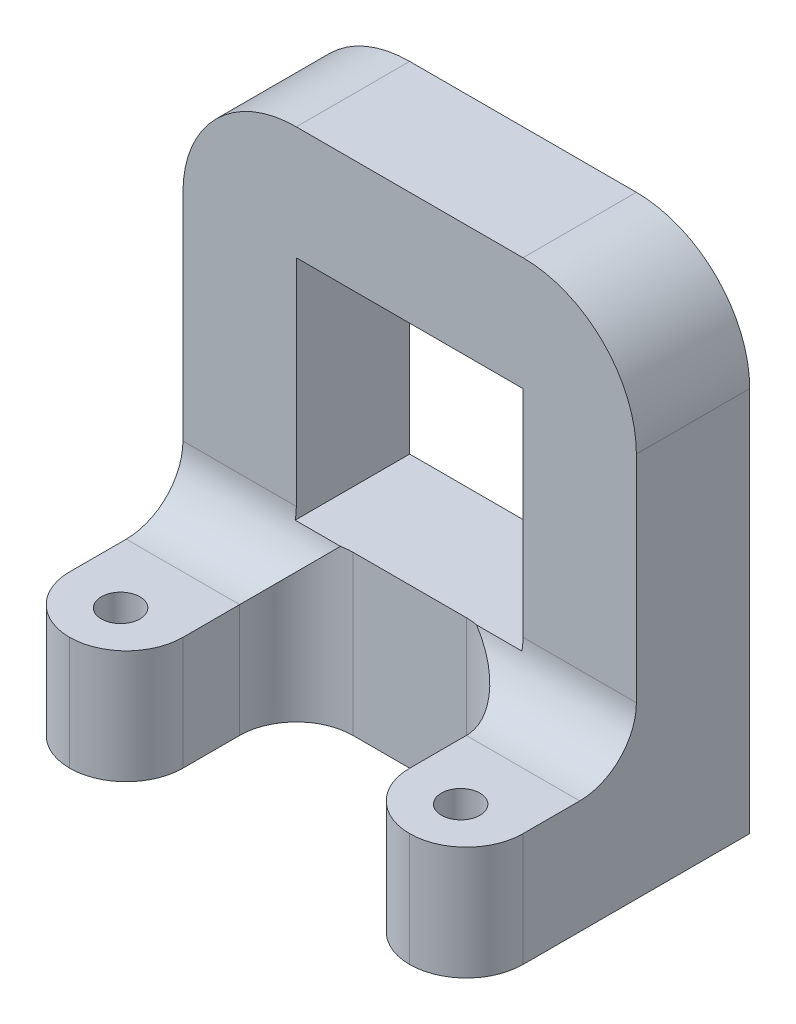
from build123d import *

# Parameters (mm, degrees)
ESQUISSE1_W        = 40
ESQUISSE1_H        = 44
ESQUISSE1_W_2      = 20
ESQUISSE1_H_2      = 20
BOSS_EXTRU_1_DEPTH = 10
ESQUISSE3_W        = 10
ESQUISSE3_H        = 10
BOSS_EXTRU_2_DEPTH = 15
D_GAGEMENT_M31_D   = 3.4
CONG_2_R           = 10
CONG_3_R           = 5


with BuildPart() as part:
    # Esquisse1 → Boss.-Extru.1 (new body)
    with BuildSketch(Plane.XY):
        with Locations((20, 22)):
            Rectangle(ESQUISSE1_W, ESQUISSE1_H)
        with Locations((20, 24)):
            Rectangle(ESQUISSE1_W_2, ESQUISSE1_H_2, mode=Mode.SUBTRACT)
    extrude(amount=BOSS_EXTRU_1_DEPTH)

    # Esquisse3 → Boss.-Extru.2 (add)
    with BuildSketch(Plane.XY.offset(10)):
        with Locations((35, 5)):
            Rectangle(ESQUISSE3_W, ESQUISSE3_H)
        with Locations((5, 5)):
            Rectangle(ESQUISSE3_W, ESQUISSE3_H)
    extrude(amount=BOSS_EXTRU_2_DEPTH)

    # Dégagement M31 (through all)
    with Locations(Plane(origin=(0, 10, 0), x_dir=(1, 0, 0), z_dir=(0, 1, 0))):
        with Locations((5, -20.5), (35, -20.5)):
            Hole(D_GAGEMENT_M31_D / 2)

    # Congé2
    cong_2_edges = [part.edges().sort_by_distance(p)[0] for p in [
        (0, 44, 5),
        (40, 44, 5),
    ]]
    fillet(cong_2_edges, radius=CONG_2_R)

    # Congé3
    # the kernel refuses this fillet: 5 mm, written as the material it adds along each edge
    with BuildSketch(Plane(origin=(40, 10, 10), x_dir=(0, 1, 0), z_dir=(-1, 0, 0)), Plane(origin=(30, 10, 10), x_dir=(-1, 0, 0), z_dir=(0, -1, 0))) as cong_3_piece_1:
        with BuildLine():
            CenterArc((CONG_3_R, -CONG_3_R), CONG_3_R, 90, 90)
            Line((0, -CONG_3_R), (0, 0))
            Line((0, 0), (CONG_3_R, 0))
        make_face()
    extrude(amount=10)
    with BuildSketch(Plane(origin=(0, 10, 10), x_dir=(0, 1, 0), z_dir=(1, 0, 0)), Plane(origin=(10, 10, 10), x_dir=(1, 0, 0), z_dir=(0, -1, 0))) as cong_3_piece_2:
        with BuildLine():
            CenterArc((CONG_3_R, CONG_3_R), CONG_3_R, 180, 90)
            Line((0, CONG_3_R), (0, 0))
            Line((0, 0), (CONG_3_R, 0))
        make_face()
    extrude(amount=10)
    with BuildSketch(Plane(origin=(30, 22.5, 10), x_dir=(-1, 0, 0), z_dir=(0, -1, 0))) as cong_3_piece_3a_section:
        with BuildLine():
            CenterArc((CONG_3_R, -CONG_3_R), CONG_3_R, 90, 90)
            Line((0, -CONG_3_R), (0, 0))
            Line((0, 0), (CONG_3_R, 0))
        make_face()
    cong_3_piece_3a = extrude(amount=22.5, mode=Mode.PRIVATE)
    cong_3_piece_3a = split(cong_3_piece_3a, bisect_by=Plane(origin=(28.868024429, 14, 11.131975571), z_dir=(0, -1, 0)), keep=Keep.TOP, mode=Mode.PRIVATE)
    cong_3_piece_3a = split(cong_3_piece_3a, bisect_by=Plane(origin=(28.868024429, 10, 11.131975571), z_dir=(0, 1, 0)), keep=Keep.TOP, mode=Mode.PRIVATE)
    with BuildSketch(Plane(origin=(40, 10, 10), x_dir=(0, 1, 0), z_dir=(-1, 0, 0))) as cong_3_piece_3b_section:
        with BuildLine():
            CenterArc((CONG_3_R, -CONG_3_R), CONG_3_R, 90, 90)
            Line((0, -CONG_3_R), (0, 0))
            Line((0, 0), (CONG_3_R, 0))
        make_face()
    cong_3_piece_3b = extrude(amount=22.5, mode=Mode.PRIVATE)
    cong_3_piece_3b = split(cong_3_piece_3b, bisect_by=Plane(origin=(30, 11.061263152, 11.15683257), z_dir=(-1, 0, 0)), keep=Keep.TOP, mode=Mode.PRIVATE)
    cong_3_piece_3b = split(cong_3_piece_3b, bisect_by=Plane(origin=(23.75, 14, 11.15683257), z_dir=(0, -1, 0)), keep=Keep.TOP, mode=Mode.PRIVATE)
    cong_3_piece_3 = cong_3_piece_3a & cong_3_piece_3b
    add(cong_3_piece_3)
    with BuildSketch(Plane(origin=(0, 10, 10), x_dir=(0, 1, 0), z_dir=(1, 0, 0))) as cong_3_piece_4a_section:
        with BuildLine():
            CenterArc((CONG_3_R, CONG_3_R), CONG_3_R, 180, 90)
            Line((0, CONG_3_R), (0, 0))
            Line((0, 0), (CONG_3_R, 0))
        make_face()
    cong_3_piece_4a = extrude(amount=22.5, mode=Mode.PRIVATE)
    cong_3_piece_4a = split(cong_3_piece_4a, bisect_by=Plane(origin=(10, 11.061263152, 11.15683257), z_dir=(1, 0, 0)), keep=Keep.TOP, mode=Mode.PRIVATE)
    cong_3_piece_4a = split(cong_3_piece_4a, bisect_by=Plane(origin=(16.25, 14, 11.15683257), z_dir=(0, -1, 0)), keep=Keep.TOP, mode=Mode.PRIVATE)
    with BuildSketch(Plane(origin=(10, 22.5, 10), x_dir=(1, 0, 0), z_dir=(0, -1, 0))) as cong_3_piece_4b_section:
        with BuildLine():
            CenterArc((CONG_3_R, CONG_3_R), CONG_3_R, 180, 90)
            Line((0, CONG_3_R), (0, 0))
            Line((0, 0), (CONG_3_R, 0))
        make_face()
    cong_3_piece_4b = extrude(amount=22.5, mode=Mode.PRIVATE)
    cong_3_piece_4b = split(cong_3_piece_4b, bisect_by=Plane(origin=(11.131975571, 14, 11.131975571), z_dir=(0, -1, 0)), keep=Keep.TOP, mode=Mode.PRIVATE)
    cong_3_piece_4b = split(cong_3_piece_4b, bisect_by=Plane(origin=(11.131975571, 10, 11.131975571), z_dir=(0, 1, 0)), keep=Keep.TOP, mode=Mode.PRIVATE)
    cong_3_piece_4 = cong_3_piece_4a & cong_3_piece_4b
    add(cong_3_piece_4)
    # the kernel refuses this fillet: 5 mm, written as the material it takes off along each edge
    with BuildSketch(Plane(origin=(40, -12.5, 25), x_dir=(0, 0, -1), z_dir=(0, 1, 0)), Plane(origin=(30, 22.5, 25), x_dir=(0, 0, -1), z_dir=(0, -1, 0))) as cong_3_2_piece_1:
        with BuildLine():
            CenterArc((CONG_3_R, CONG_3_R), CONG_3_R, 180, 90)
            Line((0, CONG_3_R), (0, 0))
            Line((0, 0), (CONG_3_R, 0))
        make_face()
    extrude(amount=35, mode=Mode.SUBTRACT)
    with BuildSketch(Plane(origin=(10, 22.5, 25), x_dir=(0, 0, -1), z_dir=(0, -1, 0)), Plane(origin=(0, -12.5, 25), x_dir=(0, 0, -1), z_dir=(0, 1, 0))) as cong_3_2_piece_2:
        with BuildLine():
            CenterArc((CONG_3_R, -CONG_3_R), CONG_3_R, 90, 90)
            Line((0, -CONG_3_R), (0, 0))
            Line((0, 0), (CONG_3_R, 0))
        make_face()
    extrude(amount=35, mode=Mode.SUBTRACT)


solid = part.part
